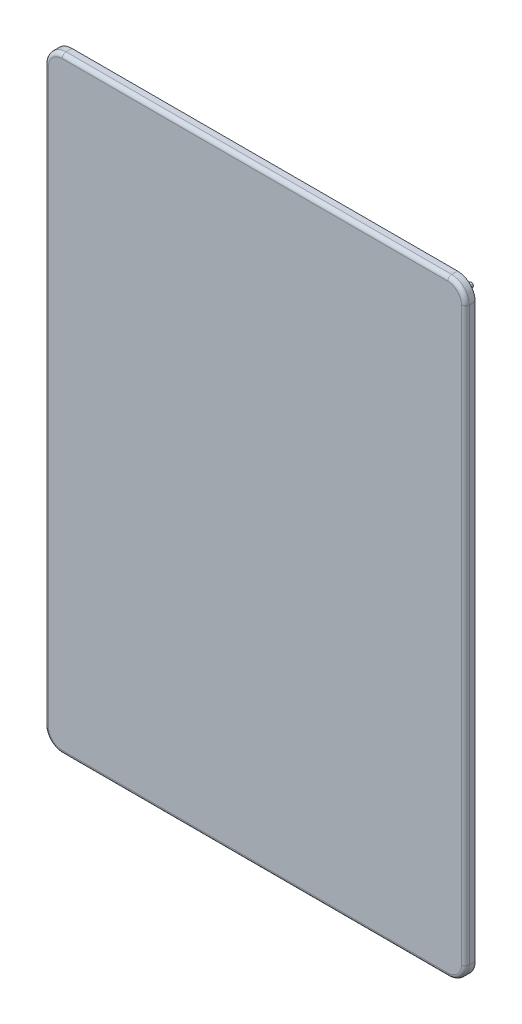
from build123d import *

# Parameters (mm, degrees)
SKETCH1_W           = 273.05
SKETCH1_H           = 393.7
BOSS_EXTRUDE1_DEPTH = 6.35
FILLET2_R           = 11.43
FILLET1_R           = 2.54
SKETCH2_R           = 1.397
BOSS_EXTRUDE2_DEPTH = 4.699
BOSS_EXTRUDE3_DEPTH = 6.35


with BuildPart() as part:
    # Sketch1 → Boss-Extrude1 (new body)
    with BuildSketch(Plane.XY):
        with Locations((136.525, 196.85)):
            Rectangle(SKETCH1_W, SKETCH1_H)
    extrude(amount=BOSS_EXTRUDE1_DEPTH)

    # Fillet2
    fillet2_edges = [part.edges().sort_by_distance(p)[0] for p in [
        (0, 0, 3.175),
        (273.05, 0, 3.175),
        (0, 393.7, 3.175),
        (273.05, 393.7, 3.175),
    ]]
    fillet(fillet2_edges, radius=FILLET2_R)

    # Fillet1
    fillet1_edges = [part.edges().sort_by_distance(p)[0] for p in [
        (136.525, 393.7, 6.35),
        (273.05, 196.85, 6.35),
        (136.525, 0, 6.35),
        (0, 196.85, 6.35),
        (3.347769491, 390.352230509, 6.35),
        (269.702230509, 390.352230509, 6.35),
        (269.702230509, 3.347769491, 6.35),
        (3.347769491, 3.347769491, 6.35),
    ]]
    fillet(fillet1_edges, radius=FILLET1_R)

    # Sketch2 → Boss-Extrude2 (add)
    with BuildSketch(Plane(origin=(0, 0, 0), x_dir=(-1, 0, 0), z_dir=(0, 0, -1))):
        with Locations((-265.811, 385.826)):
            Circle(SKETCH2_R)
        with Locations((-136.525, 385.826)):
            Circle(SKETCH2_R)
        with Locations((-7.239, 385.826)):
            Circle(SKETCH2_R)
        with Locations((-7.239, 196.85)):
            Circle(SKETCH2_R)
        with Locations((-136.525, 7.874)):
            Circle(SKETCH2_R)
        with Locations((-7.239, 7.874)):
            Circle(SKETCH2_R)
        with Locations((-265.811, 196.85)):
            Circle(SKETCH2_R)
        with Locations((-265.811, 7.874)):
            Circle(SKETCH2_R)
    extrude(amount=BOSS_EXTRUDE2_DEPTH)

    # Sketch3 → Boss-Extrude3 (add)
    with BuildSketch(Plane(origin=(0, 9.779, 0), x_dir=(-1, 0, 0), z_dir=(0, -1, 0))):
        with BuildLine():
            Line((-240.03, 0), (-240.03, 0.254))
            Line((-240.03, 0.254), (-233.7435, 0.254))
            ThreePointArc((-233.7435, 0.254), (-233.204684633, 0.477184633), (-232.9815, 1.016))
            Line((-232.9815, 1.016), (-232.9815, 1.27))
            ThreePointArc((-232.9815, 1.27), (-230.9495, 3.302), (-228.9175, 1.27))
            Line((-228.9175, 1.27), (-228.9175, 1.016))
            ThreePointArc((-228.9175, 1.016), (-228.694315367, 0.477184633), (-228.1555, 0.254))
            Line((-228.1555, 0.254), (-221.869, 0.254))
            Line((-221.869, 0.254), (-221.869, 0))
            Line((-221.869, 0), (-240.03, 0))
        make_face()
    extrude(amount=-BOSS_EXTRUDE3_DEPTH)


solid = part.part
